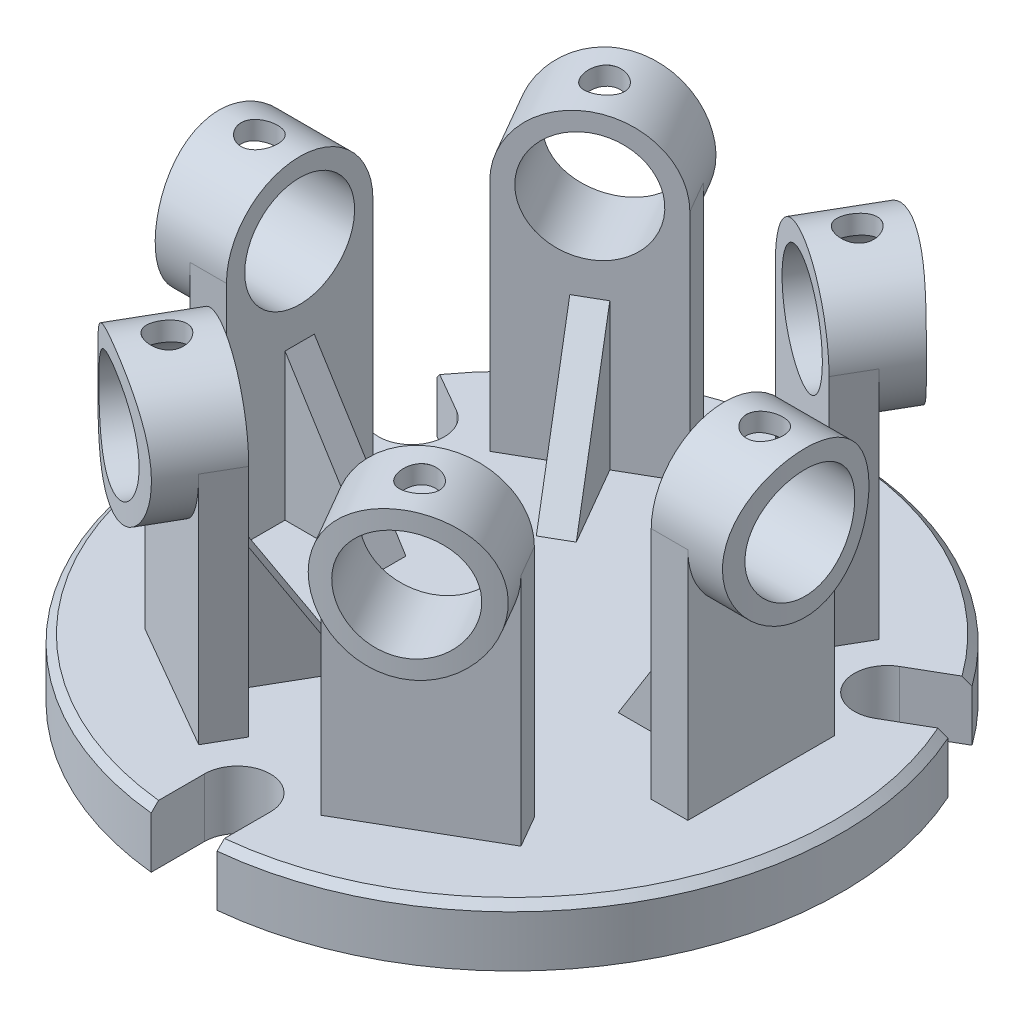
from build123d import *
from build123d.topology import SkipClean

# Parameters (mm, degrees)
SKETCH1_R           = 90
BOSS_EXTRUDE1_DEPTH = 16
CUT_EXTRUDE4_REACH  = 130.281
CIRPATTERN12_COUNT  = 3
BOSS_EXTRUDE2_DEPTH = 4
SKETCH6_W           = 4
SKETCH6_H           = 40
BOSS_EXTRUDE6_DEPTH = 22
CUT_EXTRUDE3_START  = -12
CUT_EXTRUDE3_DEPTH  = 12
CHAMFER2_SIZE       = 2
CIRPATTERN13_COUNT  = 6
CUT_EXTRUDE5_START  = -56
SKETCH17_R          = 90
SKETCH17_R_2        = 80
CUT_EXTRUDE5_DEPTH  = 40.000001


# Read off the part's stored shape, not the designer's step: Ø10.0mm Dowel Hole2
with BuildPart() as part:
    # Sketch1 → Boss-Extrude1 (new body)
    with BuildSketch(Plane(origin=(0, 0, 0), x_dir=(1, 0, 0), z_dir=(0, 1, 0))):
        with Locations(Location((0, 0, 0), (0, 0, 270))):
            Circle(SKETCH1_R)
    extrude(amount=BOSS_EXTRUDE1_DEPTH)

    # Sketch16 → Cut-Extrude4 (cut, up to next)
    with BuildSketch(Plane(origin=(0, 16, 0), x_dir=(1, 0, 0), z_dir=(0, 1, 0)), mode=Mode.PRIVATE) as cut_extrude4_sk1:
        with BuildLine():
            Line((-9, -75), (-9, -89.54886934))
            ThreePointArc((-9, -89.54886934), (0, -90), (9, -89.54886934))
            Line((9, -89.54886934), (9, -75))
            ThreePointArc((9, -75), (0, -66), (-9, -75))
        make_face()
    cut_extrude4_tool1 = extrude(cut_extrude4_sk1.sketch, amount=-CUT_EXTRUDE4_REACH, mode=Mode.PRIVATE) & part.part
    cut_extrude4 = cut_extrude4_tool1.solids().sort_by_distance((0, 16, 78.798959))[0]
    add(cut_extrude4, mode=Mode.SUBTRACT)

    # CirPattern12: Cut-Extrude4 ×3 about axis
    cirpattern12_axis = Axis((0, 0, 0), (0, 1, 0))
    for i in range(1, CIRPATTERN12_COUNT):
        add(cut_extrude4.rotate(cirpattern12_axis, i * 360 / CIRPATTERN12_COUNT), mode=Mode.SUBTRACT)

    # Sketch2 → Boss-Extrude2 (add, symmetric)
    with BuildSketch(Plane.XY):
        Polygon((-33, 16), (-58, 16), (-58, 56), align=None)
    boss_extrude2 = extrude(amount=BOSS_EXTRUDE2_DEPTH, both=True)

    # Sketch6 → Boss-Extrude6 (add)
    with BuildSketch(Plane.ZY.offset(58)):
        Polygon((20, 60), (0, 60), (0, 56), (4, 56), (4, 16), (20, 16), align=None)
        Polygon((-20, 60), (-20, 16), (-4, 16), (-4, 56), (0, 56), (0, 60), align=None)
        with Locations((-2, 36)):
            Rectangle(SKETCH6_W, SKETCH6_H)
        with Locations((2, 36)):
            Rectangle(SKETCH6_W, SKETCH6_H)
        with BuildLine():
            Line((-20, 80), (-20, 60))
            Line((-20, 60), (0, 60))
            ThreePointArc((0, 60), (-14.142135624, 65.857864376), (-20, 80))
        make_face()
        with BuildLine():
            ThreePointArc((20, 80), (14.142135624, 65.857864376), (0, 60))
            Line((0, 60), (20, 60))
            Line((20, 60), (20, 80))
        make_face()
        with BuildLine():
            ThreePointArc((0, 100), (-14.142135624, 94.142135624), (-20, 80))
            ThreePointArc((-20, 80), (-14.142135624, 65.857864376), (0, 60))
            Line((0, 60), (0, 65))
            ThreePointArc((0, 65), (-15, 80), (0, 95))
            Line((0, 95), (0, 100))
        make_face()
        with BuildLine():
            Line((0, 65), (0, 60))
            ThreePointArc((0, 60), (14.142135624, 65.857864376), (20, 80))
            ThreePointArc((20, 80), (14.142135624, 94.142135624), (0, 100))
            Line((0, 100), (0, 95))
            ThreePointArc((0, 95), (10.606601718, 90.606601718), (15, 80))
            ThreePointArc((15, 80), (10.606601718, 69.393398282), (0, 65))
        make_face()
    boss_extrude6 = extrude(amount=BOSS_EXTRUDE6_DEPTH)

    # Sketch13 → Cut-Extrude3 (cut)
    with SkipClean():  # the faces are left unmerged after this step: merging them gives an invalid solid
        with BuildSketch(Plane.ZY.offset(80).offset(CUT_EXTRUDE3_START)):
            with BuildLine():
                Line((-20, 16), (20, 16))
                Line((20, 16), (20, 80))
                ThreePointArc((20, 80), (0, 60), (-20, 80))
                Line((-20, 80), (-20, 16))
            make_face()
        cut_extrude3 = extrude(amount=CUT_EXTRUDE3_DEPTH, mode=Mode.SUBTRACT)

    # Ø10.0mm Dowel Hole2 outline → Ø10.0mm Dowel Hole2 (revolve, cut)
    with SkipClean():  # the faces are left unmerged after this step: merging them gives an invalid solid
        with BuildSketch(Plane(origin=(-69, 0, 0), x_dir=(1, 0, 0), z_dir=(0, 0, 1))):
            Polygon((5.025017551, 100.000017551), (0, 100.000017551), (0, 94.141632894), (5, 94.141632894), (5, 99.975), align=None)
        f_10_0mm_dowel_hole2 = revolve(axis=Axis((-69, 0, 0), (0, 1, 0)), mode=Mode.SUBTRACT)

    # Chamfer2
    chamfer2_edges = [part.edges().sort_by_distance(p)[0] for p in [
        (0, 16, -90),
        (-77.942286341, 16, 45),
        (77.942286341, 16, 45),
    ]]
    chamfer(chamfer2_edges, length=CHAMFER2_SIZE)

    # CirPattern13: Boss-Extrude2, Boss-Extrude6, Cut-Extrude3, Ø10.0mm Dowel Hole2 ×6 about axis
    with SkipClean():  # the faces are left unmerged after this step: merging them gives an invalid solid
        cirpattern13_axis = Axis((0, 0, 0), (0, 1, 0))
        add([boss_extrude2.rotate(cirpattern13_axis, i * 360 / CIRPATTERN13_COUNT) for i in range(1, CIRPATTERN13_COUNT)])
        add([boss_extrude6.rotate(cirpattern13_axis, i * 360 / CIRPATTERN13_COUNT) for i in range(1, CIRPATTERN13_COUNT)])
        add([cut_extrude3.rotate(cirpattern13_axis, i * 360 / CIRPATTERN13_COUNT) for i in range(1, CIRPATTERN13_COUNT)], mode=Mode.SUBTRACT)
        add([f_10_0mm_dowel_hole2.rotate(cirpattern13_axis, i * 360 / CIRPATTERN13_COUNT) for i in range(1, CIRPATTERN13_COUNT)], mode=Mode.SUBTRACT)

    # Sketch17 → Cut-Extrude5 (cut)
    with BuildSketch(Plane(origin=(0, 116, 0), x_dir=(1, 0, 0), z_dir=(0, 1, 0)).offset(CUT_EXTRUDE5_START)):
        Circle(SKETCH17_R)
        Circle(SKETCH17_R_2, mode=Mode.SUBTRACT)
    extrude(amount=CUT_EXTRUDE5_DEPTH, mode=Mode.SUBTRACT)


solid = part.part
